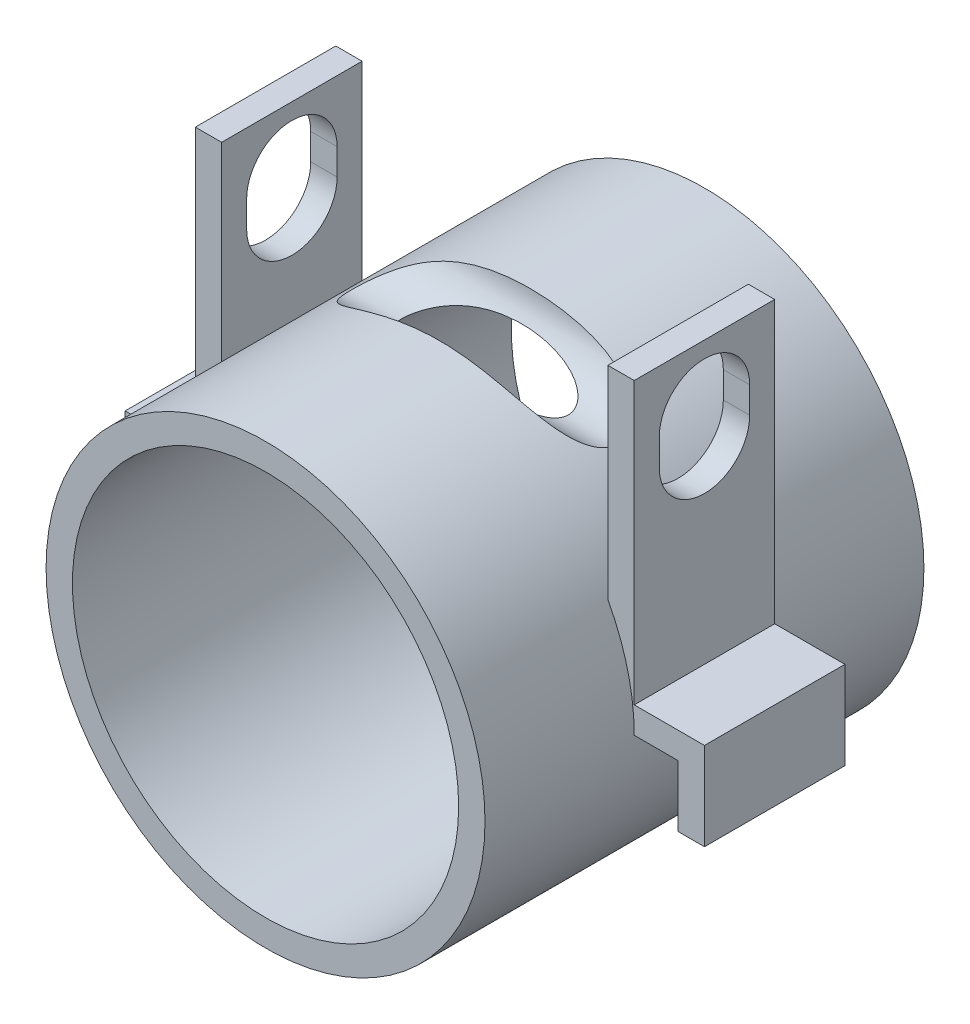
from build123d import *

# Parameters (mm, degrees)
SKETCH1_R           = 25
SKETCH1_R_2         = 22
BOSS_EXTRUDE1_DEPTH = 50
SKETCH3_R           = 5.15
CUT_EXTRUDE1_DEPTH  = 25
BOSS_EXTRUDE2_DEPTH = 8
BOSS_EXTRUDE3_DEPTH = 8
CUT_EXTRUDE3_DEPTH  = 85.196199499


with BuildPart() as part:
    # Sketch1 → Boss-Extrude1 (new body)
    with BuildSketch(Plane.XY):
        Circle(SKETCH1_R)
        Circle(SKETCH1_R_2, mode=Mode.SUBTRACT)
    extrude(amount=BOSS_EXTRUDE1_DEPTH)

    # Sketch3 → Cut-Extrude1 (cut, symmetric)
    with BuildSketch(Plane(origin=(0, 0, 0), x_dir=(0, 0, -1), z_dir=(1, 0, 0))):
        with Locations((-25, 25)):
            Circle(SKETCH3_R)
    extrude(amount=CUT_EXTRUDE1_DEPTH, both=True, mode=Mode.SUBTRACT)

    # Sketch4 → Boss-Extrude2 (add, symmetric)
    with BuildSketch(Plane.XY.offset(25)):
        with BuildLine():
            Line((-22, 11.874342087), (-22, 35))
            Line((-22, 35), (-25, 35))
            Line((-25, 35), (-25, 0))
            ThreePointArc((-25, 0), (-24.238399287, 6.123724357), (-22, 11.874342087))
        make_face()
    boss_extrude2 = extrude(amount=BOSS_EXTRUDE2_DEPTH, both=True)

    # Sketch6 → Boss-Extrude3 (add, symmetric)
    with BuildSketch(Plane.XY.offset(25)):
        Polygon((-30, 0), (-25, 0), (-25, 3), (-33, 3), (-33, -7), (-30, -7), align=None)
    boss_extrude3 = extrude(amount=BOSS_EXTRUDE3_DEPTH, both=True)

    # Mirror1: Boss-Extrude2, Boss-Extrude3 across plane
    add(boss_extrude2.mirror(Plane(origin=(0, 0, 0), x_dir=(0, 0, 1), z_dir=(1, 0, 0))))
    add(boss_extrude3.mirror(Plane(origin=(0, 0, 0), x_dir=(0, 0, 1), z_dir=(1, 0, 0))))

    # Sketch5 → Cut-Extrude3 (cut, through all)
    with BuildSketch(Plane.ZY.offset(25)):
        with BuildLine():
            Line((19.85, 25), (19.85, 28))
            ThreePointArc((19.85, 28), (25, 33.15), (30.15, 28))
            Line((30.15, 28), (30.15, 25))
            ThreePointArc((30.15, 25), (25, 19.85), (19.85, 25))
        make_face()
    extrude(amount=-CUT_EXTRUDE3_DEPTH, mode=Mode.SUBTRACT)


solid = part.part
